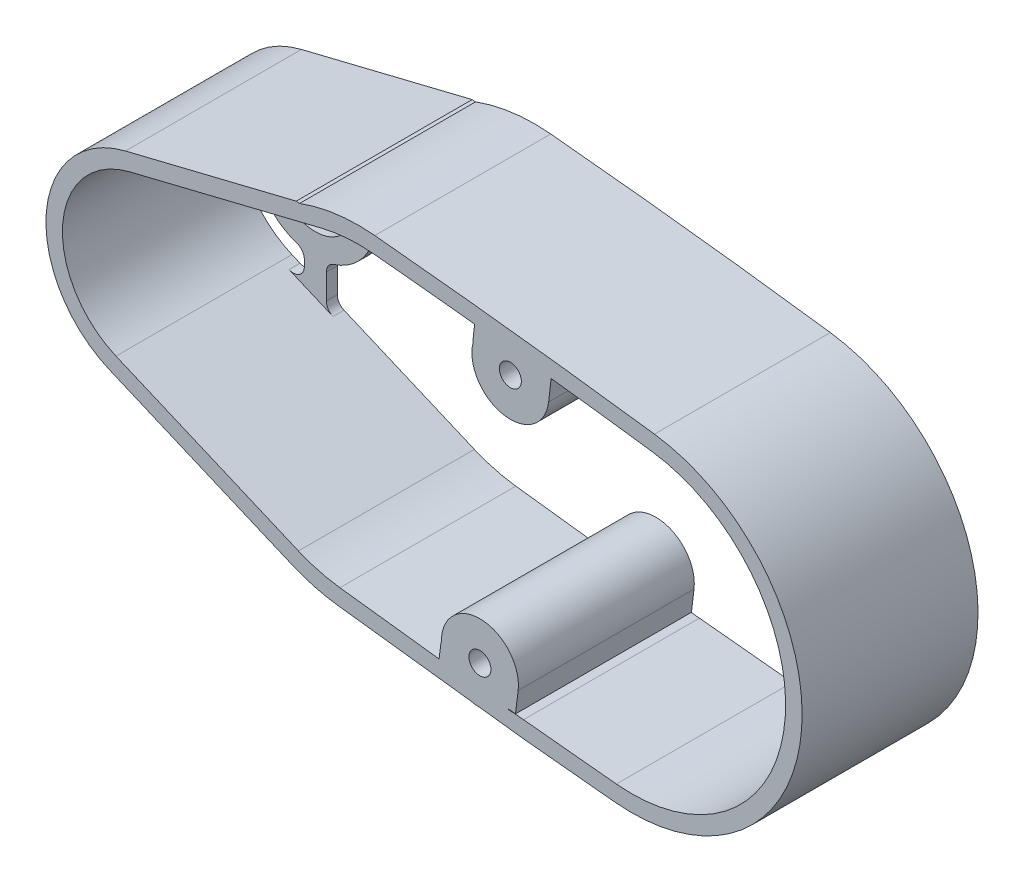
from build123d import *

# Parameters (mm, degrees)
SKETCH1_R           = 0.9999999999999983
SKETCH1_R_2         = 0.9999999999999925
BOSS_EXTRUDE1_DEPTH = 16
SKETCH2_R           = 3.500000000000001
BOSS_EXTRUDE3_DEPTH = 1
FILLET1_R           = 1


with BuildPart() as part:
    # Sketch1 → Boss-Extrude1 (new body)
    with BuildSketch(Plane.XY):
        with BuildLine():
            ThreePointArc((55.89259723337368, 76.62547740283708), (55.73949455446561, 76.6384916731646), (55.58638884526515, 76.65147024516648))
            Line((55.586388845264466, 76.65147024517492), (40.05447850145701, 72.83576058817667))
            ThreePointArc((40.054478501457005, 72.83576058817668), (32.85162294085296, 64.37296720932677), (38.606783148321924, 54.86622586508078))
            Line((38.60678314832193, 54.86622586508078), (55.19963694216289, 47.81802020858516))
            ThreePointArc((55.19963694216289, 47.81802020858516), (57.2484781716781, 47.11230292338465), (59.37571808447544, 46.69921985208524))
            Line((59.375718084475444, 46.69921985208528), (71.42380227491209, 45.2239648632993))
            ThreePointArc((71.42380227491209, 45.22396486329929), (71.86683077979774, 45.14046516807511), (72.31691713492577, 45.1146053890486))
            Line((72.31691713492577, 45.11460538904862), (76.10592748748196, 44.65065142451647))
            Line((76.10592748748196, 44.65065142451647), (84.55064590566833, 43.80531307650732))
            ThreePointArc((84.55064590566833, 43.805313076507325), (101.48886829968637, 57.421563726672275), (88.16345849536586, 74.58953137529774))
            ThreePointArc((88.16345849536584, 74.58953137529784), (75.46175434404655, 76.17510896963688), (62.73170883439283, 77.5142452500271))
            ThreePointArc((62.73170883439284, 77.5142452500271), (59.262094380223, 77.45506508921636), (55.89259723337367, 76.62547740283709))
        make_face()
        with BuildLine():
            ThreePointArc((59.557725585447635, 48.18813669728694), (57.63650253765193, 48.561246371899415), (55.78608310126676, 49.19862909689187))
            Line((55.78608310126676, 49.19862909689187), (39.19322930742587, 56.24683475338757))
            ThreePointArc((39.19322930742587, 56.246834753387574), (34.34677860639931, 64.25251167485804), (40.41234118375017, 71.37907452020546))
            Line((40.41234118375017, 71.37907452020545), (57.91952888483379, 75.68004868881708))
            ThreePointArc((57.91952888483379, 75.6800486888171), (60.24003267144862, 76.04713848925702), (62.589247617854994, 76.02102564066264))
            ThreePointArc((62.589247617854994, 76.02102564066263), (67.20240478832663, 75.56451764159874), (71.81223656797964, 75.07557020476702))
            Line((71.81223656797964, 75.07557020476696), (71.64178678398153, 73.59342993840335))
            ThreePointArc((71.64178678398147, 73.59342993840333), (71.65659417306406, 73.58005511327626), (71.67138433211107, 73.56666123728807))
            ThreePointArc((71.67138433211102, 73.56666123728805), (74.42615226207305, 69.25624682134095), (78.53896424094067, 72.29815352793712))
            Line((78.53896424094067, 72.29815352793712), (78.76640123459923, 74.2758241266035))
            ThreePointArc((78.76640123459923, 74.27582412660365), (83.36688258884593, 73.70556283958138), (87.96323868046352, 73.10295408981267))
            ThreePointArc((87.96323868046352, 73.10295408981273), (99.9990926972691, 57.59640266524784), (84.70005311557539, 45.2978536909054))
            Line((84.70005311557539, 45.29785369090539), (76.25533469738902, 46.14319203891454))
            ThreePointArc((76.25533469738902, 46.14319203891455), (75.56489776696996, 46.20456627537837), (74.87326752192872, 46.25058318457722))
            ThreePointArc((74.87326752192874, 46.25058318457718), (74.89840357996093, 46.278324250051526), (74.92324149301305, 46.306332573854725))
            Line((74.92324149301308, 46.30633257385466), (75.52663710324227, 46.23243513010978))
            Line((75.52663710324227, 46.2324351301098), (75.76626292593124, 48.189054495825076))
            ThreePointArc((75.76626292593126, 48.189054495825076), (72.46724927571279, 52.11013899674976), (68.79305098926964, 48.53821211065343))
            ThreePointArc((68.79305098926967, 48.53821211065338), (68.77357245948804, 48.527397725244626), (68.75407840556292, 48.51661134884714))
            Line((68.75407840556268, 48.51661134884727), (68.57854942467414, 47.08336263050453))
            Line((68.57854942467414, 47.08336263050455), (59.55772558544767, 48.18813669728721))
        make_face(mode=Mode.SUBTRACT)
        with Locations((75.06188190763086, 72.69802656701884)):
            Circle(SKETCH1_R, mode=Mode.SUBTRACT)
        with Locations(Location((72.29221908664718, 48.614518246022456, 0), (0, 0, 180))):
            Circle(SKETCH1_R_2, mode=Mode.SUBTRACT)
    extrude(amount=BOSS_EXTRUDE1_DEPTH)

    # Sketch2 → Boss-Extrude3 (add)
    with BuildSketch(Plane(origin=(0, 0, 0), x_dir=(-1, 0, 0), z_dir=(0, 0, -1))):
        with BuildLine():
            Line((-34.38368822278696, 64.61008215769137), (-36.91261524278492, 64.61008215769137))
            ThreePointArc((-36.91261524278492, 64.61008215769137), (-38.431854859454894, 67.49916945421737), (-41.3209421559809, 69.01840907088734))
            Line((-41.3209421559809, 69.01840907088734), (-41.3209421559809, 71.60228965777424))
            Line((-41.3209421559809, 71.60228965777424), (-43.3209421559809, 72.09362775753603))
            Line((-43.3209421559809, 72.09362775753601), (-43.3209421559809, 69.01840907088734))
            ThreePointArc((-43.3209421559809, 69.01840907088734), (-47.8209421559809, 63.61008215769136), (-43.3209421559809, 58.201755244495374))
            Line((-43.3209421559809, 58.20175524449537), (-43.3209421559809, 54.49349145216626))
            Line((-43.320942155980916, 54.493491452166296), (-41.3209421559809, 55.343038581800116))
            Line((-41.3209421559809, 55.343038581800116), (-41.3209421559809, 58.20175524449537))
            ThreePointArc((-41.3209421559809, 58.201755244495374), (-38.431854859454894, 59.72099486116535), (-36.91261524278492, 62.61008215769136))
            Line((-36.91261524278492, 62.61008215769136), (-34.38368822278692, 62.61008215769136))
            ThreePointArc((-34.383688222786944, 62.6100821576915), (-34.32094215598073, 63.61008215769144), (-34.38368822278696, 64.61008215769137))
        make_face()
        with Locations((-42.3209421559809, 63.61008215769136)):
            Circle(SKETCH2_R, mode=Mode.SUBTRACT)
    extrude(amount=-BOSS_EXTRUDE3_DEPTH)

    # Fillet1
    # the kernel refuses this fillet: 1 mm, written as the material it adds along each edge
    with BuildSketch(Plane(origin=(43.3209421559809, 69.01840907088734, 0), x_dir=(0, 1, 0), z_dir=(0, 0, 1))) as fillet1_piece_1:
        with BuildLine():
            CenterArc((0.7763315252305034, -1), FILLET1_R, 90, 72.07978686060775)
            ThreePointArc((-0.17515438837357067, -0.6923076923076934), (-0.07632915836303766, -0.3489996080267872), (0, 0))
            Line((0, 0), (0.7763315252305034, 0))
        make_face()
    extrude(amount=1)
    with BuildSketch(Plane(origin=(43.3209421559809, 72.09362775753601, 0), x_dir=(0.9711240453142455, 0.23857512152882837, 0), z_dir=(0, 0, 1))) as fillet1_piece_2:
        with BuildLine():
            CenterArc((FILLET1_R * 0.784065518865, -FILLET1_R), FILLET1_R, 90.00000000000067, 76.19754186301965)
            Line((-FILLET1_R * 0.18705852645, -FILLET1_R * 0.761424878471), (0, 0))
            Line((0, 0), (FILLET1_R * 0.784065518865, 0))
        make_face()
    extrude(amount=1)
    with BuildSketch(Plane(origin=(41.3209421559809, 71.60228965777424, 0), x_dir=(-0.9693820258646232, -0.24555750432556298, 0), z_dir=(0, 0, 1))) as fillet1_piece_3:
        with BuildLine():
            CenterArc((1.2846787374655042, 0.9991324752357655), FILLET1_R, 165.78521711475895, 106.60154959902064)
            Line((0.31529671160088446, 1.2446899795613422), (0.21835850901442075, 1.2692457299938988))
            Line((0.21835850901442075, 1.2692457299938988), (-0.0969382025864637, 0.02455575043255665))
            Line((-0.0969382025864637, 0.02455575043255665), (-0.00071963623293713, -0.09999741058494188))
            ThreePointArc((-0.00071963623293713, -0.09999741058494188), (0.9348739670397286, -0.10673045549363312), (1.3304881173388574, -0.09991324752357857))
            Line((1.3304881173388574, -0.09991324752357857), (1.3263236282594648, 2e-17))
        make_face()
    extrude(amount=1)
    with BuildSketch(Plane(origin=(34.38368822278696, 64.61008215769137, 0), x_dir=(0.20605308678190415, 0.9785408143903089, 0), z_dir=(0, 0, 1))) as fillet1_piece_4:
        with BuildLine():
            CenterArc((1.2317903608426914, -0.9966225018240038), FILLET1_R, 85.28960309121933, 106.60154959901973)
            Line((0.25324954645238257, -1.202675588605908), (0, 0))
            ThreePointArc((0, 0), (0.6569548591160989, 0.02701998540798078), (1.3139097182321993, 1e-17))
        make_face()
    extrude(amount=1)
    with BuildSketch(Plane(origin=(34.38368822278693, 62.61008215769143, 0), x_dir=(0.206053086781914, -0.9785408143903069, 0), z_dir=(0, 0, 1))) as fillet1_piece_5:
        with BuildLine():
            CenterArc((1.231790360842777, 0.9966225018240046), FILLET1_R, 168.10884730976036, 106.60154959901973)
            Line((0.2532495464524701, 1.2026755886059186), (0, 0))
            ThreePointArc((0, 0), (0.6569548591161378, -0.02701998540797386), (1.3139097182322748, -1e-17))
        make_face()
    extrude(amount=1)
    with BuildSketch(Plane(origin=(41.3209421559809, 58.201755244495374, 0), x_dir=(0, -1, 0), z_dir=(0, 0, 1))) as fillet1_piece_6:
        with BuildLine():
            CenterArc((0.7763315252304963, -1), FILLET1_R, 90, 72.07978686060738)
            ThreePointArc((-0.17515438837357777, -0.6923076923076863), (-0.07632915836303766, -0.3489996080267801), (0, 0))
            Line((0, 0), (0.7763315252304963, 0))
        make_face()
    extrude(amount=1)
    with BuildSketch(Plane(origin=(41.3209421559809, 55.343038581800116, 0), x_dir=(-0.9204059255379603, 0.390964106069356, 0), z_dir=(0, 0, 1))) as fillet1_piece_7:
        with BuildLine():
            CenterArc((FILLET1_R * 1.51125070741, -FILLET1_R), FILLET1_R, 89.99999999999925, 113.0145022041728)
            Line((FILLET1_R * 0.590844781867, -FILLET1_R * 1.39096410607), (0, 0))
            Line((0, 0), (FILLET1_R * 1.51125070741, 3e-17))
        make_face()
    extrude(amount=1)
    with BuildSketch(Plane(origin=(43.32094215598091, 54.49349145216628, 0), x_dir=(0.9204059255379384, -0.3909641060694075, 0), z_dir=(0, 0, 1))) as fillet1_piece_8:
        with BuildLine():
            CenterArc((FILLET1_R * 0.661703577772, FILLET1_R), FILLET1_R, 203.01450220417283, 66.98549779582959)
            Line((-FILLET1_R * 0.258702347766, FILLET1_R * 0.609035893931), (0, 0))
            Line((0, 0), (FILLET1_R * 0.661703577772, 0))
        make_face()
    extrude(amount=1)
    with BuildSketch(Plane(origin=(36.91261524278492, 64.61008215769137, 0), x_dir=(-1, 0, 0), z_dir=(0, 0, 1))) as fillet1_piece_9:
        with BuildLine():
            CenterArc((0.7763315252305034, -1), FILLET1_R, 90, 72.07978686060696)
            ThreePointArc((-0.17515438837357067, -0.6923076923076792), (-0.07632915836303766, -0.348999608026773), (0, 0))
            Line((0, 0), (0.7763315252305034, 0))
        make_face()
    extrude(amount=1)
    with BuildSketch(Plane(origin=(43.3209421559809, 58.201755244495374, 0), x_dir=(0, -1, 0), z_dir=(0, 0, 1))) as fillet1_piece_10:
        with BuildLine():
            CenterArc((0.7763315252305034, 1), FILLET1_R, 197.92021313939225, 72.07978686060778)
            ThreePointArc((-0.17515438837357067, 0.6923076923076934), (-0.07632915836303766, 0.3489996080267872), (0, 0))
            Line((0, 0), (0.7763315252305034, 0))
        make_face()
    extrude(amount=1)
    with BuildSketch(Plane(origin=(41.3209421559809, 69.01840907088734, 0), x_dir=(-0.9694541372423533, -0.24527265600487255, 0), z_dir=(0, 0, 1))) as fillet1_piece_11:
        with BuildLine():
            CenterArc((0.779041242108754, -0.9978904650112504), FILLET1_R, 93.72226572150103, 72.07978686060773)
            Line((-0.1904128951335993, -0.7526178090063779), (0, 0))
            ThreePointArc((0, 0), (0.35706056929984037, -0.01160244243811416), (0.7141211385996942, -1e-17))
        make_face()
    extrude(amount=1)
    with BuildSketch(Plane(origin=(36.91261524278492, 62.61008215769136, 0), x_dir=(0.2452726560048725, -0.9694541372423532, 0), z_dir=(0, 0, 1))) as fillet1_piece_12:
        with BuildLine():
            CenterArc((0.7790412421087539, -0.9978904650112503), FILLET1_R, 93.72226572150103, 72.07978686060773)
            Line((-0.19041289513359927, -0.7526178090063779), (0, 0))
            ThreePointArc((0, 0), (0.3570605692998403, -0.01160244243811414), (0.7141211385996941, 2e-17))
        make_face()
    extrude(amount=1)


solid = part.part
